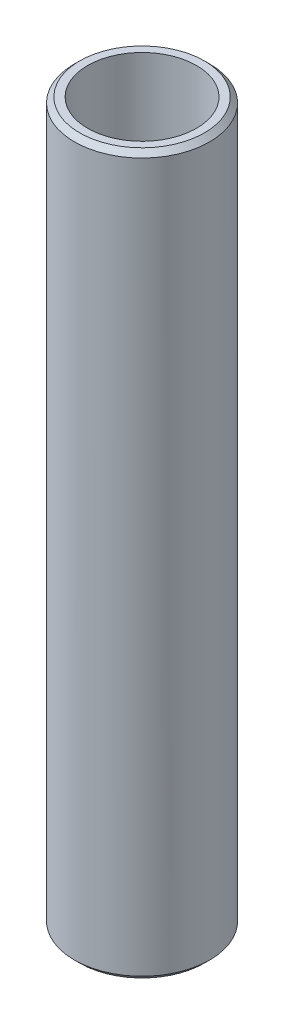
from build123d import *

# Parameters (mm, degrees)
SKETCH1_R           = 32.5
BOSS_EXTRUDE1_DEPTH = 345.746391026
SKETCH2_R           = 26.177636266
CUT_EXTRUDE1_DEPTH  = 349.78799708
CHAMFER1_SIZE       = 2.499433


with BuildPart() as part:
    # Sketch1 → Boss-Extrude1 (new body)
    with BuildSketch(Plane(origin=(0, 0, 0), x_dir=(1, 0, 0), z_dir=(0, 1, 0))):
        Circle(SKETCH1_R)
    extrude(amount=BOSS_EXTRUDE1_DEPTH)

    # Sketch2 → Cut-Extrude1 (cut, through all)
    with BuildSketch(Plane(origin=(0, 0, 0), x_dir=(1, 0, 0), z_dir=(0, 1, 0))):
        Circle(SKETCH2_R)
    extrude(amount=CUT_EXTRUDE1_DEPTH, mode=Mode.SUBTRACT)

    # Chamfer1
    chamfer1_edges = [part.edges().sort_by_distance(p)[0] for p in [
        (-32.5, 345.746391026, 0),
        (-32.5, 0, 0),
    ]]
    chamfer(chamfer1_edges, length=CHAMFER1_SIZE)


solid = part.part
